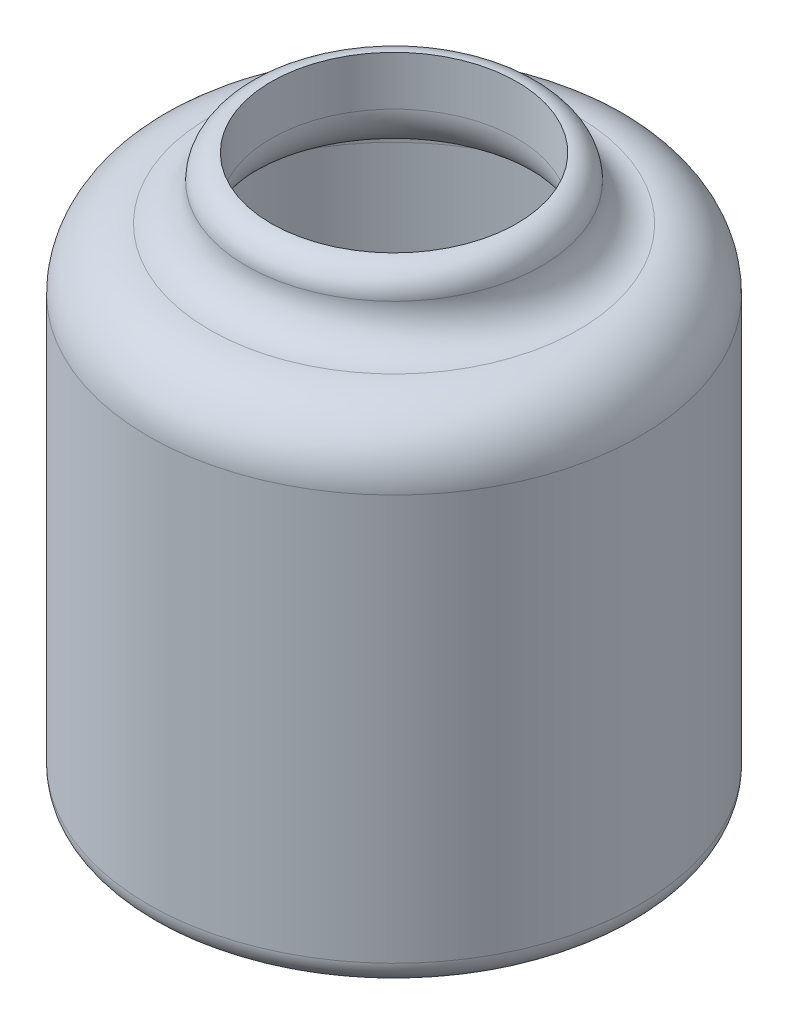
from build123d import *

# Parameters (mm, degrees)
SKETCH1_R           = 100
BOSS_EXTRUDE2_DEPTH = 200
SKETCH4_R           = 60
BOSS_EXTRUDE5_DEPTH = 25
SKETCH5_R           = 50
CUT_EXTRUDE2_DEPTH  = 210
FILLET2_R           = 10
FILLET3_R           = 10
FILLET4_R           = 15
FILLET5_R           = 25
SKETCH6_R           = 90
CUT_EXTRUDE4_DEPTH  = 170
FILLET7_R           = 20
FILLET8_R           = 20
FILLET9_R           = 10


with BuildPart() as part:
    # Sketch1 → Boss-Extrude2 (new body)
    with BuildSketch(Plane(origin=(0, 0, 0), x_dir=(1, 0, 0), z_dir=(0, 1, 0))):
        with Locations(Location((0, 0, 0), (0, 0, 270))):
            Circle(SKETCH1_R)
    extrude(amount=BOSS_EXTRUDE2_DEPTH)

    # Sketch4 → Boss-Extrude5 (add)
    with BuildSketch(Plane(origin=(0, 200, 0), x_dir=(1, 0, 0), z_dir=(0, 1, 0))):
        with Locations(Location((0, 0, 0), (0, 0, 270))):
            Circle(SKETCH4_R)
    extrude(amount=BOSS_EXTRUDE5_DEPTH)

    # Sketch5 → Cut-Extrude2 (cut)
    with BuildSketch(Plane(origin=(0, 225, 0), x_dir=(1, 0, 0), z_dir=(0, 1, 0))):
        with Locations(Location((0, 0, 0), (0, 0, 270))):
            Circle(SKETCH5_R)
    extrude(amount=-CUT_EXTRUDE2_DEPTH, mode=Mode.SUBTRACT)

    # Fillet2
    fillet2_edges = [part.edges().sort_by_distance(p)[0] for p in [
        (0, 0, -100),
    ]]
    fillet(fillet2_edges, radius=FILLET2_R)

    # Fillet3
    fillet3_edges = [part.edges().sort_by_distance(p)[0] for p in [
        (0, 225, -60),
    ]]
    fillet(fillet3_edges, radius=FILLET3_R - 0.0001)  # a hair under: the kernel refuses the full size

    # Fillet4
    fillet4_edges = [part.edges().sort_by_distance(p)[0] for p in [
        (0, 200, -60),
    ]]
    fillet(fillet4_edges, radius=FILLET4_R)

    # Fillet5
    fillet5_edges = [part.edges().sort_by_distance(p)[0] for p in [
        (0, 200, -100),
    ]]
    fillet(fillet5_edges, radius=FILLET5_R - 0.0001)  # a hair under: the kernel refuses the full size

    # Sketch6 → Cut-Extrude4 (cut)
    with BuildSketch(Plane(origin=(0, 15, 0), x_dir=(1, 0, 0), z_dir=(0, 1, 0))):
        with Locations(Location((0, 0, 0), (0, 0, 270))):
            Circle(SKETCH6_R)
    extrude(amount=CUT_EXTRUDE4_DEPTH, mode=Mode.SUBTRACT)

    # Fillet7
    fillet7_edges = [part.edges().sort_by_distance(p)[0] for p in [
        (0, 185, -90),
    ]]
    fillet(fillet7_edges, radius=FILLET7_R)

    # Fillet8
    fillet8_edges = [part.edges().sort_by_distance(p)[0] for p in [
        (0, 185, -50),
    ]]
    fillet(fillet8_edges, radius=FILLET8_R - 0.0001)  # a hair under: the kernel refuses the full size

    # Fillet9
    fillet9_edges = [part.edges().sort_by_distance(p)[0] for p in [
        (0, 15, -90),
    ]]
    fillet(fillet9_edges, radius=FILLET9_R)


solid = part.part
